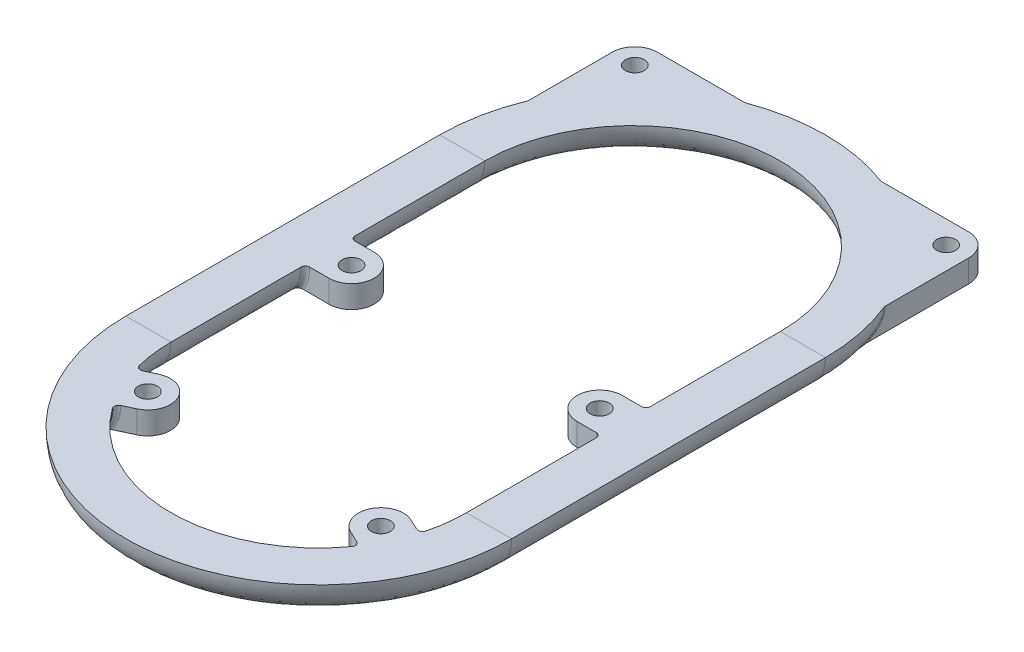
from build123d import *

# Parameters (mm, degrees)
BOSS_EXTRUDE1_DEPTH      = 1.478256
BOSS_EXTRUDE1_DEPTH_BACK = 3.521744
SKETCH4_R                = 2.1
FILLET1_R                = 1
BOSS_EXTRUDE2_DEPTH      = 1.478256
BOSS_EXTRUDE2_DEPTH_BACK = 3.521744
SKETCH5_R                = 2.1
FILLET3_R                = 1
BOSS_EXTRUDE3_DEPTH      = 1.478256
BOSS_EXTRUDE3_DEPTH_BACK = 3.521744
SKETCH6_R                = 2.1
FILLET4_R                = 1


with BuildPart() as part:
    # Sweep1: sweep along a path in Sketch1
    with BuildLine(Plane(origin=(0, 0, 0), x_dir=(1, 0, 0), z_dir=(0, 1, 0))) as sweep1_path:
        Line((-37.5, -69.569134335), (-37.5, 0))
        ThreePointArc((-37.5, 0), (0, 37.5), (37.5, 0))
        Line((37.5, 0), (37.5, -69.569134335))
        ThreePointArc((37.5, -69.569134335), (0, -107.069134335), (-37.5, -69.569134335))
    # Sketch2 → Sweep1 (sweep)
    with BuildSketch(Plane.XY):
        with BuildLine():
            Line((39.5, 0), (36, 0))
            Line((36, 0), (36, -3.5))
            Line((36, -3.5), (37, -3.5))
            Line((37, -3.5), (37, -5))
            add(Edge.make_bspline(
                [(37, -5), (32.910177503, -3.900260556), (32.75, 1.478256238)],
                knots=[0, 0, 0, 0.917743894, 0.917743894, 0.917743894], degree=2))
            Line((32.75, 1.478256238), (42.75, 1.478256238))
            add(Edge.make_bspline(
                [(38.5, -5), (42.589822497, -3.900260556), (42.75, 1.478256238)],
                knots=[0, 0, 0, 0.917743894, 0.917743894, 0.917743894], degree=2))
            Line((38.5, -5), (38.5, -3.5))
            Line((38.5, -3.5), (39.5, -3.5))
            Line((39.5, -3.5), (39.5, 0))
        make_face()
    sweep(path=sweep1_path.line)

    # Sketch4 → Boss-Extrude1 (add, two sides: drawn at the far end of the back side and taken through both)
    # profile 1 of 2: a face of its own
    with BuildSketch(Plane(origin=(0, 0, 0), x_dir=(1, 0, 0), z_dir=(0, 1, 0)).offset(-BOSS_EXTRUDE1_DEPTH_BACK)):
        with BuildLine():
            Line((-39.5, 35), (-39.5, 11.093910035))
            ThreePointArc((-39.5, 11.093910035), (-28.285456328, 29.719653433), (-9.128244073, 40))
            Line((-9.128244073, 40), (-34.5, 40))
            ThreePointArc((-34.5, 40), (-38.035533906, 38.535533906), (-39.5, 35))
        make_face()
        with Locations(Location((-34.5, 35, 0), (0, 0, 270))):
            Circle(SKETCH4_R, mode=Mode.SUBTRACT)
    # profile 2 of 2: a face of its own
    with BuildSketch(Plane(origin=(0, 0, 0), x_dir=(1, 0, 0), z_dir=(0, 1, 0)).offset(-BOSS_EXTRUDE1_DEPTH_BACK)):
        with BuildLine():
            Line((34.5, 40), (9.128244073, 40))
            ThreePointArc((9.128244073, 40), (28.285456328, 29.719653433), (39.5, 11.093910035))
            Line((39.5, 11.093910035), (39.5, 35))
            ThreePointArc((39.5, 35), (38.035533906, 38.535533906), (34.5, 40))
        make_face()
        with Locations(Location((34.5, 35, 0), (0, 0, 270))):
            Circle(SKETCH4_R, mode=Mode.SUBTRACT)
    extrude(amount=BOSS_EXTRUDE1_DEPTH + BOSS_EXTRUDE1_DEPTH_BACK)

    # Fillet1
    fillet1_edges = [part.edges().sort_by_distance(p)[0] for p in [
        (-28.320526862, -3.521744, -29.735630535),
        (-13.06360371, -1.949480131, -40),
        (-39.5, -1.838045086, -14.640945529),
        (28.320526862, -3.521744, -29.735630535),
        (13.063603708, -1.949480129, -40),
        (39.5, -1.838045085, -14.640945528),
    ]]
    fillet(fillet1_edges, radius=FILLET1_R)

    # Sketch5 → Boss-Extrude2 (add, two sides: drawn at the far end of the back side and taken through both)
    # profile 1 of 2: a face of its own
    with BuildSketch(Plane(origin=(0, 0, 0), x_dir=(1, 0, 0), z_dir=(0, 1, 0)).offset(-BOSS_EXTRUDE2_DEPTH_BACK)):
        with BuildLine():
            Line((-27.5, -39.784567168), (-35.5, -39.784567168))
            Line((-35.5, -39.784567168), (-35.5, -29.784567168))
            Line((-35.5, -29.784567168), (-27.5, -29.784567168))
            ThreePointArc((-27.5, -29.784567168), (-22.5, -34.784567168), (-27.5, -39.784567168))
        make_face()
        with Locations(Location((-27.5, -34.784567168, 0), (0, 0, 270))):
            Circle(SKETCH5_R, mode=Mode.SUBTRACT)
    # profile 2 of 2: a face of its own
    with BuildSketch(Plane(origin=(0, 0, 0), x_dir=(1, 0, 0), z_dir=(0, 1, 0)).offset(-BOSS_EXTRUDE2_DEPTH_BACK)):
        with BuildLine():
            Line((35.5, -29.784567168), (27.5, -29.784567168))
            ThreePointArc((27.5, -29.784567168), (22.5, -34.784567168), (27.5, -39.784567168))
            Line((27.5, -39.784567168), (35.5, -39.784567168))
            Line((35.5, -39.784567168), (35.5, -29.784567168))
        make_face()
        with Locations(Location((27.5, -34.784567168, 0), (0, 0, 270))):
            Circle(SKETCH5_R, mode=Mode.SUBTRACT)
    extrude(amount=BOSS_EXTRUDE2_DEPTH + BOSS_EXTRUDE2_DEPTH_BACK)

    # Fillet3
    fillet3_edges = [part.edges().sort_by_distance(p)[0] for p in [
        (-34.435904186, -3.521744, 34.784567168),
        (-33.143042055, -1.182469725, 39.784567168),
        (-33.143042055, -1.182469725, 29.784567168),
        (34.435904186, -3.521744, 34.784567168),
        (33.143042055, -1.182469725, 29.784567168),
        (33.143042055, -1.182469725, 39.784567168),
    ]]
    fillet(fillet3_edges, radius=FILLET3_R)

    # Sketch6 → Boss-Extrude3 (add, two sides: drawn at the far end of the back side and taken through both)
    # profile 1 of 2: a face of its own
    with BuildSketch(Plane(origin=(0, 0, 0), x_dir=(1, 0, 0), z_dir=(0, 1, 0)).offset(-BOSS_EXTRUDE3_DEPTH_BACK)):
        with BuildLine():
            Line((-33.508513998, -79.677521431), (-27.942863239, -77.08221586))
            ThreePointArc((-27.942863239, -77.08221586), (-21.298232995, -79.500663486), (-23.716680622, -86.14529373))
            Line((-23.716680622, -86.14529373), (-29.28233138, -88.740599301))
            ThreePointArc((-29.28233138, -88.740599301), (-31.720772546, -84.360773496), (-33.508513998, -79.677521431))
        make_face()
        with Locations(Location((-25.829771931, -81.613754795, 0), (0, 0, 270))):
            Circle(SKETCH6_R, mode=Mode.SUBTRACT)
    # profile 2 of 2: a face of its own
    with BuildSketch(Plane(origin=(0, 0, 0), x_dir=(1, 0, 0), z_dir=(0, 1, 0)).offset(-BOSS_EXTRUDE3_DEPTH_BACK)):
        with BuildLine():
            Line((29.28233138, -88.740599301), (23.716680622, -86.14529373))
            ThreePointArc((23.716680622, -86.14529373), (21.298232995, -79.500663486), (27.942863239, -77.08221586))
            Line((27.942863239, -77.08221586), (33.508513998, -79.677521431))
            ThreePointArc((33.508513998, -79.677521431), (31.720772546, -84.360773496), (29.28233138, -88.740599301))
        make_face()
        with Locations(Location((25.829771931, -81.613754795, 0), (0, 0, 270))):
            Circle(SKETCH6_R, mode=Mode.SUBTRACT)
    extrude(amount=BOSS_EXTRUDE3_DEPTH + BOSS_EXTRUDE3_DEPTH_BACK)

    # Fillet4
    fillet4_edges = [part.edges().sort_by_distance(p)[0] for p in [
        (-31.209528116, -3.521744, 84.122376303),
        (-27.581769485, -1.185558343, 87.947614267),
        (-31.807952103, -1.185558343, 78.884536396),
        (31.209528116, -3.521744, 84.122376303),
        (31.807952103, -1.185558343, 78.884536396),
        (27.581769485, -1.185558343, 87.947614267),
    ]]
    fillet(fillet4_edges, radius=FILLET4_R)


solid = part.part
